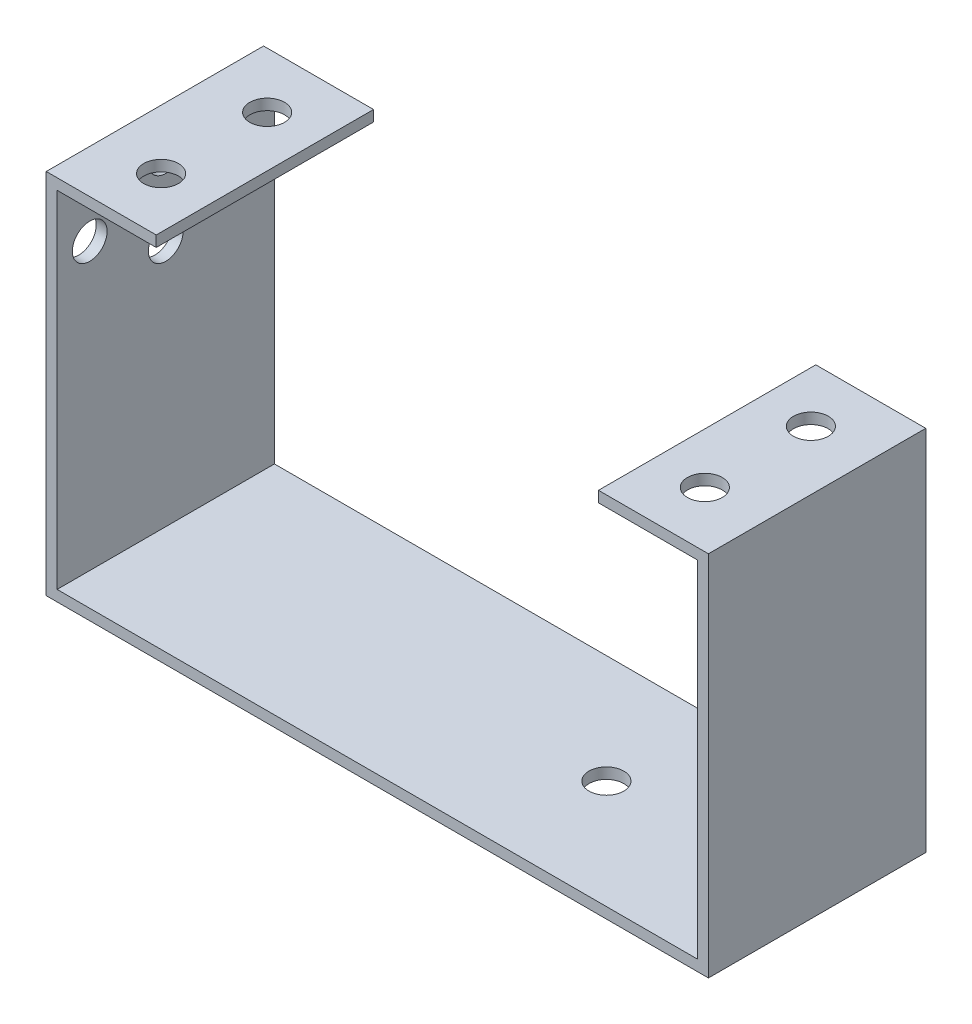
from build123d import *

# Parameters (mm, degrees)
SKETCH_2_W           = 60.94
SKETCH_2_H           = 20
EXTRUDE_1_DEPTH      = 1
SKETCH_3_W           = 1
SKETCH_3_H           = 20
EXTRUDE_2_DEPTH      = 32.81
SKETCH_4_W           = 1
SKETCH_4_H           = 20
EXTRUDE_3_DEPTH      = 32.81
SKETCH_9_W           = 20
SKETCH_9_H           = 1
EXTRUDE_8_DEPTH      = 9.12
SKETCH_10_W          = 20
SKETCH_10_H          = 1
EXTRUDE_9_DEPTH      = 9.12
SKETCH_13_R          = 1.6
CUT_EXTRUDE_2_DEPTH  = 1
SKETCH_14_R          = 1.6
CUT_EXTRUDE_3_DEPTH  = 1
SKETCH_15_R          = 1.6
CUT_EXTRUDE_4_DEPTH  = 1
SKETCH_16_R          = 1.6
CUT_EXTRUDE_5_DEPTH  = 1
SKETCH_17_R          = 1.6
CUT_EXTRUDE_6_DEPTH  = 1
SKETCH_19_R          = 1.6
CUT_EXTRUDE_7_DEPTH  = 1
SKETCH_20_R          = 1.6
CUT_EXTRUDE_8_DEPTH  = 1
SKETCH_22_R          = 1.6
CUT_EXTRUDE_9_DEPTH  = 1
SKETCH_23_R          = 1.6
CUT_EXTRUDE_10_DEPTH = 1


with BuildPart() as part:
    # ｽｹｯﾁ2 → ﾎﾞｽ - 押し出し1 (new body)
    with BuildSketch(Plane(origin=(0, 0, 0), x_dir=(1, 0, 0), z_dir=(0, 1, 0))):
        with Locations((30.47, 10)):
            Rectangle(SKETCH_2_W, SKETCH_2_H)
    extrude(amount=EXTRUDE_1_DEPTH)

    # ｽｹｯﾁ3 → ﾎﾞｽ - 押し出し2 (add)
    with BuildSketch(Plane(origin=(0, 1, 0), x_dir=(1, 0, 0), z_dir=(0, 1, 0))):
        with Locations((60.44, 10)):
            Rectangle(SKETCH_3_W, SKETCH_3_H)
    extrude(amount=EXTRUDE_2_DEPTH)

    # ｽｹｯﾁ4 → ﾎﾞｽ - 押し出し3 (add)
    with BuildSketch(Plane(origin=(0, 1, 0), x_dir=(1, 0, 0), z_dir=(0, 1, 0))):
        with Locations((0.5, 10)):
            Rectangle(SKETCH_4_W, SKETCH_4_H)
    extrude(amount=EXTRUDE_3_DEPTH)

    # ｽｹｯﾁ9 → ﾎﾞｽ - 押し出し8 (add)
    with BuildSketch(Plane.ZY.offset(-59.94)):
        with Locations((-10, 33.31)):
            Rectangle(SKETCH_9_W, SKETCH_9_H)
    extrude(amount=EXTRUDE_8_DEPTH)

    # ｽｹｯﾁ10 → ﾎﾞｽ - 押し出し9 (add)
    with BuildSketch(Plane(origin=(1, 0, 0), x_dir=(0, 0, -1), z_dir=(1, 0, 0))):
        with Locations((10, 33.31)):
            Rectangle(SKETCH_10_W, SKETCH_10_H)
    extrude(amount=EXTRUDE_9_DEPTH)

    # ｽｹｯﾁ13 → ｶｯﾄ - 押し出し2 (cut)
    with BuildSketch(Plane(origin=(0, 33.81, 0), x_dir=(1, 0, 0), z_dir=(0, 1, 0))):
        with Locations((55.49, 5.12)):
            Circle(SKETCH_13_R)
    extrude(amount=-CUT_EXTRUDE_2_DEPTH, mode=Mode.SUBTRACT)

    # ｽｹｯﾁ14 → ｶｯﾄ - 押し出し3 (cut)
    with BuildSketch(Plane(origin=(0, 33.81, 0), x_dir=(1, 0, 0), z_dir=(0, 1, 0))):
        with Locations((55.49, 14.88)):
            Circle(SKETCH_14_R)
    extrude(amount=-CUT_EXTRUDE_3_DEPTH, mode=Mode.SUBTRACT)

    # ｽｹｯﾁ15 → ｶｯﾄ - 押し出し4 (cut)
    with BuildSketch(Plane(origin=(0, 33.81, 0), x_dir=(1, 0, 0), z_dir=(0, 1, 0))):
        with Locations((5.45, 5.12)):
            Circle(SKETCH_15_R)
    extrude(amount=-CUT_EXTRUDE_4_DEPTH, mode=Mode.SUBTRACT)

    # ｽｹｯﾁ16 → ｶｯﾄ - 押し出し5 (cut)
    with BuildSketch(Plane(origin=(0, 33.81, 0), x_dir=(1, 0, 0), z_dir=(0, 1, 0))):
        with Locations((5.45, 14.88)):
            Circle(SKETCH_16_R)
    extrude(amount=-CUT_EXTRUDE_5_DEPTH, mode=Mode.SUBTRACT)

    # ｽｹｯﾁ17 → ｶｯﾄ - 押し出し6 (cut)
    with BuildSketch(Plane(origin=(0, 0, 0), x_dir=(-1, 0, 0), z_dir=(0, -1, 0))):
        with Locations((-41.55, 10)):
            Circle(SKETCH_17_R)
    extrude(amount=-CUT_EXTRUDE_6_DEPTH, mode=Mode.SUBTRACT)

    # ｽｹｯﾁ19 → ｶｯﾄ - 押し出し7 (cut)
    with BuildSketch(Plane.ZY):
        with Locations((-3, 27.25)):
            Circle(SKETCH_19_R)
    extrude(amount=-CUT_EXTRUDE_7_DEPTH, mode=Mode.SUBTRACT)

    # ｽｹｯﾁ20 → ｶｯﾄ - 押し出し8 (cut)
    with BuildSketch(Plane.ZY):
        with Locations((-17, 27.25)):
            Circle(SKETCH_20_R)
    extrude(amount=-CUT_EXTRUDE_8_DEPTH, mode=Mode.SUBTRACT)

    # ｽｹｯﾁ22 → ｶｯﾄ - 押し出し9 (cut)
    with BuildSketch(Plane.ZY):
        with Locations((-10, 23.75)):
            Circle(SKETCH_22_R)
    extrude(amount=-CUT_EXTRUDE_9_DEPTH, mode=Mode.SUBTRACT)

    # ｽｹｯﾁ23 → ｶｯﾄ - 押し出し10 (cut)
    with BuildSketch(Plane.ZY):
        with Locations((-10, 30.75)):
            Circle(SKETCH_23_R)
    extrude(amount=-CUT_EXTRUDE_10_DEPTH, mode=Mode.SUBTRACT)


solid = part.part
